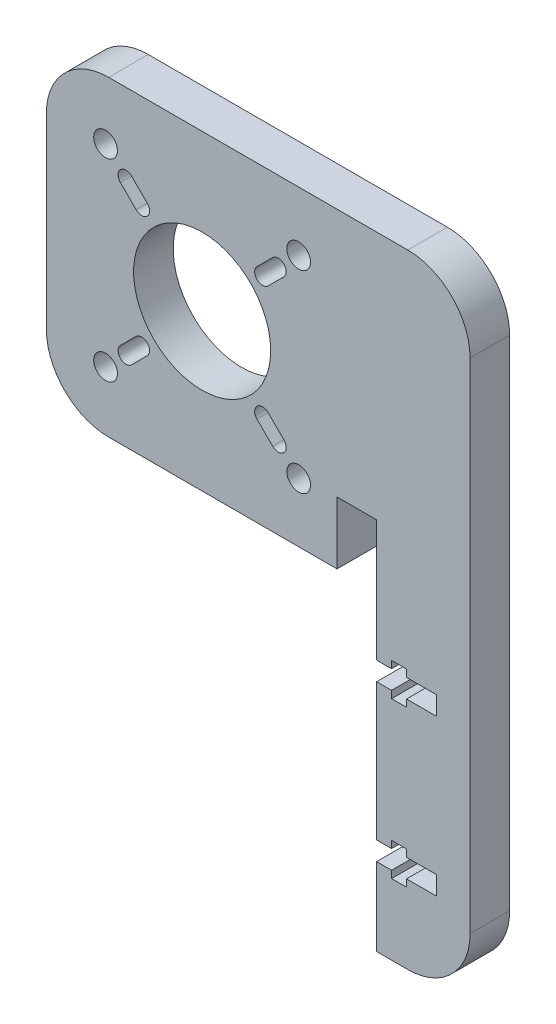
from build123d import *

# Parameters (mm, degrees)
SKETCH1_R           = 1.905
SKETCH1_R_2         = 11
BOSS_EXTRUDE1_DEPTH = 6.35
FILLET1_R           = 10


with BuildPart() as part:
    # Sketch1 → Boss-Extrude1 (new body)
    with BuildSketch(Plane.XY):
        Polygon((21.65, -15), (28, -15), (28, -34.5), (30.4, -34.5), (30.4, -33.34), (32.8, -33.34), (32.8, -34.5), (37.65, -34.5), (37.65, -37.5), (32.8, -37.5), (32.8, -38.66), (30.4, -38.66), (30.4, -37.5), (28, -37.5), (28, -59.5), (30.4, -59.5), (30.4, -58.34), (32.8, -58.34), (32.8, -59.5), (37.65, -59.5), (37.65, -62.5), (32.8, -62.5), (32.8, -63.66), (30.4, -63.66), (30.4, -62.5), (28, -62.5), (28, -75), (43, -75), (43, 25), (-25, 25), (-25, -25), (21.65, -25), align=None)
        with Locations((-15.494, -15.494)):
            Circle(SKETCH1_R, mode=Mode.SUBTRACT)
        with BuildLine():
            ThreePointArc((-11.319365353, -13.115416577), (-13.115416577, -13.115416577), (-13.115416577, -11.319365353))
            Line((-13.115416577, -11.319365353), (-10.600944864, -8.804893639))
            ThreePointArc((-10.600944864, -8.804893639), (-8.804893639, -8.804893639), (-8.804893639, -10.600944864))
            Line((-8.804893639, -10.600944864), (-11.319365353, -13.115416577))
        make_face(mode=Mode.SUBTRACT)
        with BuildLine():
            ThreePointArc((-13.115416577, 11.319365353), (-13.115416577, 13.115416577), (-11.319365353, 13.115416577))
            Line((-11.319365353, 13.115416577), (-8.804893639, 10.600944864))
            ThreePointArc((-8.804893639, 10.600944864), (-8.804893639, 8.804893639), (-10.600944864, 8.804893639))
            Line((-10.600944864, 8.804893639), (-13.115416577, 11.319365353))
        make_face(mode=Mode.SUBTRACT)
        with Locations((-15.494, 15.494)):
            Circle(SKETCH1_R, mode=Mode.SUBTRACT)
        Circle(SKETCH1_R_2, mode=Mode.SUBTRACT)
        with Locations((15.494, -15.494)):
            Circle(SKETCH1_R, mode=Mode.SUBTRACT)
        with BuildLine():
            ThreePointArc((13.115416577, -11.319365353), (13.115416577, -13.115416577), (11.319365353, -13.115416577))
            Line((11.319365353, -13.115416577), (8.804893639, -10.600944864))
            ThreePointArc((8.804893639, -10.600944864), (8.804893639, -8.804893639), (10.600944864, -8.804893639))
            Line((10.600944864, -8.804893639), (13.115416577, -11.319365353))
        make_face(mode=Mode.SUBTRACT)
        with BuildLine():
            ThreePointArc((11.319365353, 13.115416577), (13.115416577, 13.115416577), (13.115416577, 11.319365353))
            Line((13.115416577, 11.319365353), (10.600944864, 8.804893639))
            ThreePointArc((10.600944864, 8.804893639), (8.804893639, 8.804893639), (8.804893639, 10.600944864))
            Line((8.804893639, 10.600944864), (11.319365353, 13.115416577))
        make_face(mode=Mode.SUBTRACT)
        with Locations((15.494, 15.494)):
            Circle(SKETCH1_R, mode=Mode.SUBTRACT)
    extrude(amount=BOSS_EXTRUDE1_DEPTH)

    # Fillet1
    fillet1_edges = [part.edges().sort_by_distance(p)[0] for p in [
        (43, -75, 3.175),
        (43, 25, 3.175),
        (-25, -25, 3.175),
        (-25, 25, 3.175),
    ]]
    fillet(fillet1_edges, radius=FILLET1_R)


solid = part.part
